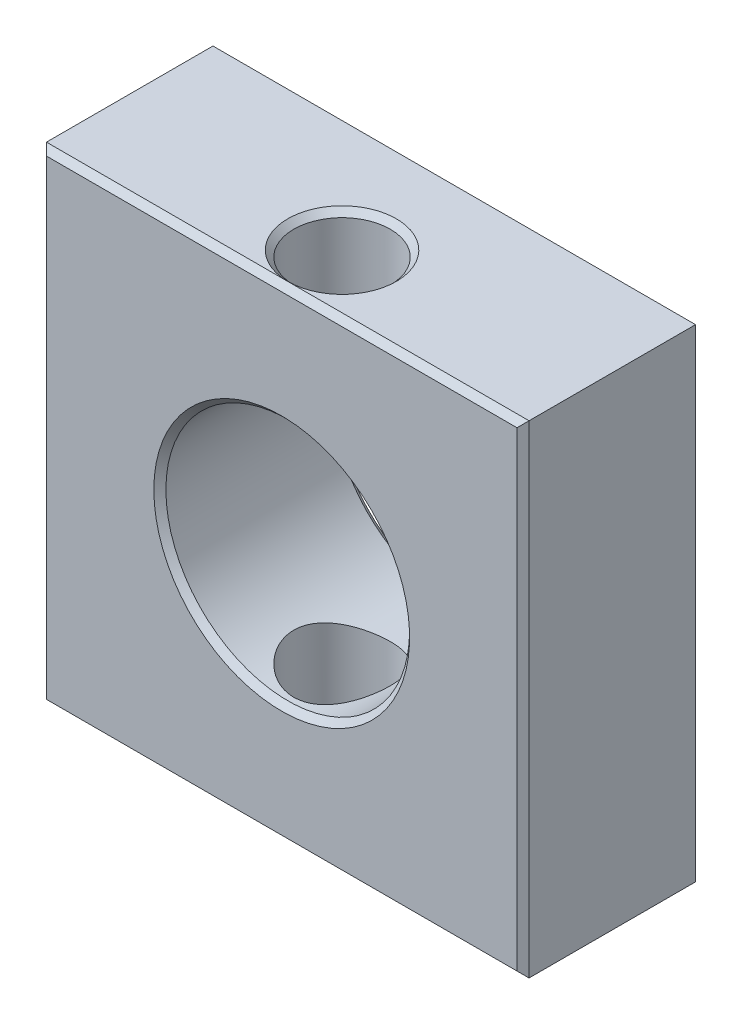
from build123d import *

# Parameters (mm, degrees)
SKETCH1_W               = 20
SKETCH1_H               = 20
SKETCH1_R               = 5.05
BOSS_EXTRUDE1_DEPTH     = 7.4
CUT_EXTRUDE1_DEPTH      = 16.961202962
CUT_EXTRUDE1_DEPTH_BACK = 16.961202962
SKETCH2_R               = 2
CHAMFER1_SIZE           = 0.25


with BuildPart() as part:
    # Sketch1 → Boss-Extrude1 (new body)
    with BuildSketch(Plane.XY):
        Rectangle(SKETCH1_W, SKETCH1_H)
        Circle(SKETCH1_R, mode=Mode.SUBTRACT)
    extrude(amount=BOSS_EXTRUDE1_DEPTH)

    # Sketch2 → Cut-Extrude1 (cut, two sides: drawn at the far end of the back side and taken through both)
    with BuildSketch(Plane(origin=(0, 0, 0), x_dir=(1, 0, 0), z_dir=(0, 1, 0)).offset(-CUT_EXTRUDE1_DEPTH_BACK)):
        with Locations(Location((0, -4.9, 0), (0, 0, 270))):
            Circle(SKETCH2_R)
    extrude(amount=CUT_EXTRUDE1_DEPTH + CUT_EXTRUDE1_DEPTH_BACK, mode=Mode.SUBTRACT)

    # Chamfer1
    chamfer1_edges = [part.edges().sort_by_distance(p)[0] for p in [
        (-5.05, 0, 0),
        (-5.05, 0, 7.4),
        (-10, 0, 7.4),
        (0, -10, 7.4),
        (0, -10, 2.9),
        (0, 10, 2.9),
        (10, 0, 7.4),
        (0, -10, 0),
        (-10, 0, 0),
        (0, 10, 0),
        (10, 0, 0),
        (0, 10, 7.4),
    ]]
    chamfer(chamfer1_edges, length=CHAMFER1_SIZE - 0.0001)  # a hair under: the kernel refuses the full size


solid = part.part
